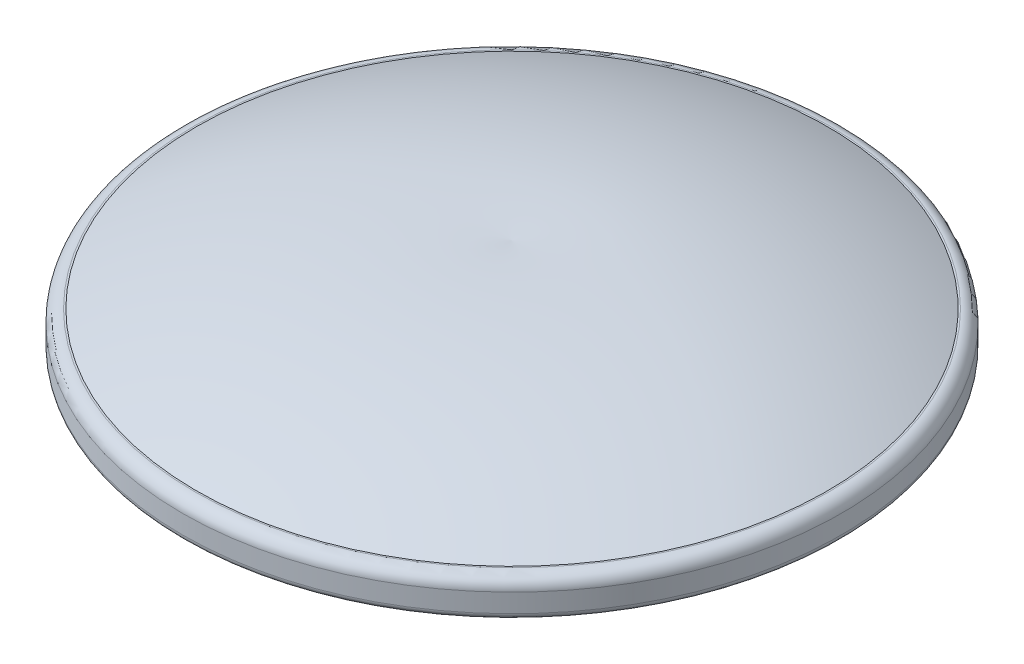
from build123d import *

# Parameters (mm, degrees)
SKETCH_1_R      = 53
EXTRUDE_1_DEPTH = 6
FILLET_3_R      = 2
FILLET_4_R      = 1
SKETCH_6_R      = 47.988125992
EXTRUDE_2_DEPTH = 0.1


# Read off the part's stored shape, not the designer's step: 抽壳2
with BuildPart() as part:
    # 草图1 → 凸台-拉伸1 (new body)
    with BuildSketch(Plane(origin=(0, 0, 0), x_dir=(1, 0, 0), z_dir=(0, 1, 0))):
        with Locations(Location((0, 0, 0), (0, 0, 270))):
            Circle(SKETCH_1_R)
    extrude(amount=EXTRUDE_1_DEPTH)

    # 草图3 → 旋转1 (revolve)
    with BuildSketch(Plane(origin=(0, 0, 0), x_dir=(0.9983570071777269, 0, -0.05729996700812362), z_dir=(0.05729996700812362, 0, 0.9983570071777269))):
        with BuildLine():
            Line((0, 15.515098755), (0, 6))
            Line((0, 6), (50.738604569, 6))
            add(Edge.make_bspline(
                [(0, 15.515098755), (27.166184936, 17.472084947), (50.738604569, 6)],
                knots=[0, 0, 0, 1, 1, 1], degree=2))
        make_face()
    revolve(axis=Axis((0, 15.515098755, 0), (0, -1, 0)))

    # 圆角3
    fillet_3_edges = [part.edges().sort_by_distance(p)[0] for p in [
        (0, 6, -53),
    ]]
    fillet(fillet_3_edges, radius=FILLET_3_R)

    # 圆角4
    fillet_4_edges = [part.edges().sort_by_distance(p)[0] for p in [
        (0, 0, -53),
    ]]
    fillet(fillet_4_edges, radius=FILLET_4_R)

    # 抽壳2 outline → 抽壳2 (revolve, cut)
    with BuildSketch(Plane.XY):
        with BuildLine():
            Line((52, 0), (52, 4))
            ThreePointArc((52, 4), (51.707106781, 4.707106781), (51, 5))
            Line((51, 5), (0, 5))
            Line((0, 5), (0, 0))
            Line((0, 0), (52, 0))
        make_face()
    revolve(axis=Axis((0, 0, 0), (0, 1, 0)), mode=Mode.SUBTRACT)

    # 草图6 → 凸台-拉伸2 (add)
    with BuildSketch(Plane.XZ.offset(-5)):
        with Locations(Location((0, 0, 0), (0, 0, 90))):
            Circle(SKETCH_6_R)
    extrude(amount=EXTRUDE_2_DEPTH)


solid = part.part
